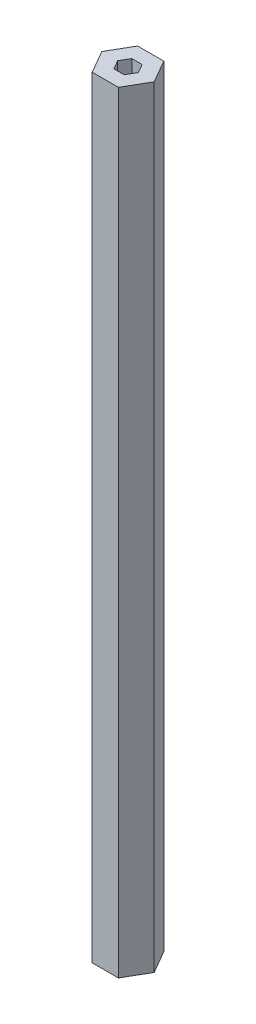
from build123d import *

# Parameters (mm, degrees)
BOSS_EXTRUDE1_DEPTH = 215.9


with BuildPart() as part:
    # Sketch1 → Boss-Extrude1 (new body)
    with BuildSketch(Plane(origin=(0, 0, 0), x_dir=(1, 0, 0), z_dir=(0, 1, 0))):
        Polygon((7.332348419, 0), (3.666174209, 6.35), (-3.666174209, 6.35), (-7.332348419, 0), (-3.666174209, -6.35), (3.666174209, -6.35), align=None)
        Polygon((1.443375673, 2.5), (-1.443375673, 2.5), (-2.886751346, 0), (-1.443375673, -2.5), (1.443375673, -2.5), (2.886751346, 0), align=None, mode=Mode.SUBTRACT)
    extrude(amount=BOSS_EXTRUDE1_DEPTH)


solid = part.part
